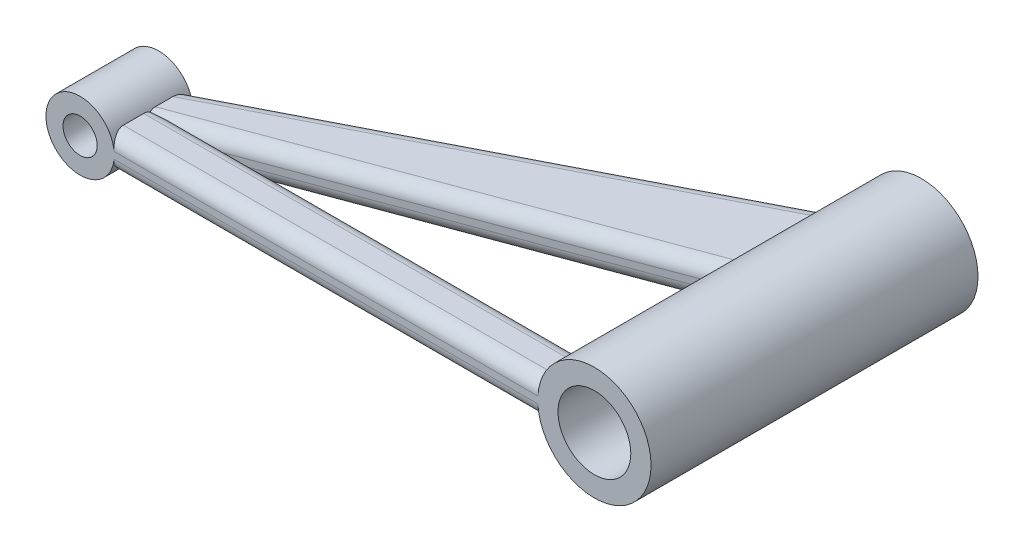
from build123d import *

# Parameters (mm, degrees)
BOSS_EXTRUDE1_DEPTH     = 10
SKETCH2_R               = 10
SKETCH2_R_2             = 5
BOSS_EXTRUDE2_DEPTH     = 23
SKETCH3_R               = 5
CUT_EXTRUDE1_DEPTH      = 27
CUT_EXTRUDE2_DEPTH      = 27
SKETCH5_R               = 16.577091043
SKETCH5_R_2             = 9.5
BOSS_EXTRUDE3_DEPTH     = 95.692095
SKETCH6_R               = 10.655
CUT_EXTRUDE3_DEPTH      = 100
CUT_EXTRUDE4_DEPTH      = 18
CUT_EXTRUDE4_DEPTH_BACK = 49
FILLET1_R               = 4


with BuildPart() as part:
    # Sketch1 → Boss-Extrude1 (new body)
    with BuildSketch(Plane(origin=(0, 0, 0), x_dir=(1, 0, 0), z_dir=(0, 1, 0))):
        Polygon((-63.967417751, -18.920698467), (86.549607935, -18.920698467), (86.549607935, 76.771396129), (-63.967417751, 4.079301533), align=None)
    extrude(amount=BOSS_EXTRUDE1_DEPTH)

    # Sketch2 → Boss-Extrude2 (add)
    with BuildSketch(Plane.XY.offset(18.920698467)):
        with Locations((-63.967417751, 5)):
            Circle(SKETCH2_R)
        with Locations((-63.967417751, 5)):
            Circle(SKETCH2_R_2, mode=Mode.SUBTRACT)
    extrude(amount=-BOSS_EXTRUDE2_DEPTH)

    # Sketch3 → Cut-Extrude1 (cut)
    with BuildSketch(Plane.XY.offset(18.920698467)):
        with Locations((-63.967417751, 5)):
            Circle(SKETCH3_R)
    extrude(amount=-CUT_EXTRUDE1_DEPTH, mode=Mode.SUBTRACT)

    # Sketch4 → Cut-Extrude2 (cut)
    with BuildSketch(Plane(origin=(0, 10, 0), x_dir=(1, 0, 0), z_dir=(0, 1, 0))):
        Polygon((-63.967417751, 4.079301533), (-55.307163713, 4.079301533), (86.549607935, 76.771396129), align=None)
    extrude(amount=-CUT_EXTRUDE2_DEPTH, mode=Mode.SUBTRACT)

    # Sketch5 → Boss-Extrude3 (add)
    with BuildSketch(Plane.XY.offset(18.920698467)):
        with Locations((86.549607935, 5)):
            Circle(SKETCH5_R)
        with Locations((86.549607935, 5)):
            Circle(SKETCH5_R_2, mode=Mode.SUBTRACT)
    extrude(amount=-BOSS_EXTRUDE3_DEPTH)

    # Sketch6 → Cut-Extrude3 (cut)
    with BuildSketch(Plane.XY.offset(18.920698467)):
        with Locations((86.549607935, 5)):
            Circle(SKETCH6_R)
    extrude(amount=-CUT_EXTRUDE3_DEPTH, mode=Mode.SUBTRACT)

    # Sketch7 → Cut-Extrude4 (cut, two sides: drawn at the far end of the back side and taken through both)
    with BuildSketch(Plane(origin=(0, 10, 0), x_dir=(1, 0, 0), z_dir=(0, 1, 0)).offset(-CUT_EXTRUDE4_DEPTH_BACK)):
        Polygon((-42.194742499, -4.96728533), (69.563656526, 36.57746749), (69.563656526, -4.96728533), align=None)
    extrude(amount=CUT_EXTRUDE4_DEPTH + CUT_EXTRUDE4_DEPTH_BACK, mode=Mode.SUBTRACT)

    # Fillet1
    # the kernel refuses this fillet: 4 mm, written as the material it takes off along each edge
    with BuildSketch(Plane(origin=(-64.206738138, 0, 0.481134309), x_dir=(0.45604358422436925, 0, 0.8899574424026075), z_dir=(0.8899574424026077, 0, -0.45604358422436925))) as fillet1_piece_1_section:
        with BuildLine():
            CenterArc((FILLET1_R, -FILLET1_R), FILLET1_R, 90, 90)
            Line((0, -FILLET1_R), (0, 0))
            Line((0, 0), (FILLET1_R, 0))
        make_face()
    fillet1_piece_1 = extrude(amount=161.63790854, mode=Mode.PRIVATE)
    fillet1_piece_1 = fillet1_piece_1 & Plane(origin=(-63.967417751, 5, 0.481134309), x_dir=(1, 0, 0), z_dir=(0, 0, 1)) * Cylinder(10, 340, mode=Mode.PRIVATE)
    fillet1_piece_1 = split(fillet1_piece_1, bisect_by=Plane(origin=(-64.206738138, 0, -4.079301533), z_dir=(0, 0, -1)), keep=Keep.TOP, mode=Mode.PRIVATE)
    add(fillet1_piece_1, mode=Mode.SUBTRACT)
    with BuildSketch(Plane(origin=(-64.206738138, 0, 0.481134309), x_dir=(0.45604358422436925, 0, 0.8899574424026075), z_dir=(0.8899574424026077, 0, -0.45604358422436925))) as fillet1_piece_2_section:
        with BuildLine():
            CenterArc((FILLET1_R, -FILLET1_R), FILLET1_R, 90, 90)
            Line((0, -FILLET1_R), (0, 0))
            Line((0, 0), (FILLET1_R, 0))
        make_face()
    fillet1_piece_2 = extrude(amount=161.63790854, mode=Mode.PRIVATE)
    fillet1_piece_2 = fillet1_piece_2 - Plane(origin=(-63.967417751, 5, 0.481134309), x_dir=(1, 0, 0), z_dir=(0, 0, 1)) * Cylinder(10, 340, mode=Mode.PRIVATE)
    fillet1_piece_2 = split(fillet1_piece_2, bisect_by=Plane(origin=(-64.206738138, 0, -4.079301533), z_dir=(0, 0, 1)), keep=Keep.TOP, mode=Mode.PRIVATE)
    add(fillet1_piece_2, mode=Mode.SUBTRACT)
    with BuildSketch(Plane(origin=(-64.206738138, 0, 0.481134309), x_dir=(0.45604358422436925, 0, 0.8899574424026075), z_dir=(0.8899574424026077, 0, -0.45604358422436925))) as fillet1_piece_3_section:
        with BuildLine():
            CenterArc((FILLET1_R, -FILLET1_R), FILLET1_R, 90, 90)
            Line((0, -FILLET1_R), (0, 0))
            Line((0, 0), (FILLET1_R, 0))
        make_face()
    fillet1_piece_3 = extrude(amount=161.63790854, mode=Mode.PRIVATE)
    fillet1_piece_3 = fillet1_piece_3 - Plane(origin=(-63.967417751, 5, 0.481134309), x_dir=(1, 0, 0), z_dir=(0, 0, 1)) * Cylinder(10, 340, mode=Mode.PRIVATE)
    fillet1_piece_3 = fillet1_piece_3 - Plane(origin=(86.549607935, 5, 0.481134309), x_dir=(1, 0, 0), z_dir=(0, 0, 1)) * Cylinder(16.577091043, 340, mode=Mode.PRIVATE)
    fillet1_piece_3 = split(fillet1_piece_3, bisect_by=Plane(origin=(-64.206738138, 0, -4.079301533), z_dir=(0, 0, -1)), keep=Keep.TOP, mode=Mode.PRIVATE)
    add(fillet1_piece_3, mode=Mode.SUBTRACT)
    with BuildSketch(Plane(origin=(-64.206738138, 10, 0.481134309), x_dir=(0.45604358422436925, 0, 0.8899574424026077), z_dir=(0.8899574424026077, 0, -0.45604358422436925))) as fillet1_piece_4_section:
        with BuildLine():
            CenterArc((FILLET1_R, FILLET1_R), FILLET1_R, 180, 90)
            Line((0, FILLET1_R), (0, 0))
            Line((0, 0), (FILLET1_R, 0))
        make_face()
    fillet1_piece_4 = extrude(amount=161.63790854, mode=Mode.PRIVATE)
    fillet1_piece_4 = fillet1_piece_4 & Plane(origin=(-63.967417751, 5, 0.481134309), x_dir=(1, 0, 0), z_dir=(0, 0, 1)) * Cylinder(10, 340, mode=Mode.PRIVATE)
    fillet1_piece_4 = split(fillet1_piece_4, bisect_by=Plane(origin=(-64.206738138, 10, -4.079301533), z_dir=(0, 0, -1)), keep=Keep.TOP, mode=Mode.PRIVATE)
    add(fillet1_piece_4, mode=Mode.SUBTRACT)
    with BuildSketch(Plane(origin=(-64.206738138, 10, 0.481134309), x_dir=(0.45604358422436925, 0, 0.8899574424026077), z_dir=(0.8899574424026077, 0, -0.45604358422436925))) as fillet1_piece_5_section:
        with BuildLine():
            CenterArc((FILLET1_R, FILLET1_R), FILLET1_R, 180, 90)
            Line((0, FILLET1_R), (0, 0))
            Line((0, 0), (FILLET1_R, 0))
        make_face()
    fillet1_piece_5 = extrude(amount=161.63790854, mode=Mode.PRIVATE)
    fillet1_piece_5 = fillet1_piece_5 - Plane(origin=(-63.967417751, 5, 0.481134309), x_dir=(1, 0, 0), z_dir=(0, 0, 1)) * Cylinder(10, 340, mode=Mode.PRIVATE)
    fillet1_piece_5 = split(fillet1_piece_5, bisect_by=Plane(origin=(-64.206738138, 10, -4.079301533), z_dir=(0, 0, 1)), keep=Keep.TOP, mode=Mode.PRIVATE)
    add(fillet1_piece_5, mode=Mode.SUBTRACT)
    with BuildSketch(Plane(origin=(-64.206738138, 10, 0.481134309), x_dir=(0.45604358422436925, 0, 0.8899574424026077), z_dir=(0.8899574424026077, 0, -0.45604358422436925))) as fillet1_piece_6_section:
        with BuildLine():
            CenterArc((FILLET1_R, FILLET1_R), FILLET1_R, 180, 90)
            Line((0, FILLET1_R), (0, 0))
            Line((0, 0), (FILLET1_R, 0))
        make_face()
    fillet1_piece_6 = extrude(amount=161.63790854, mode=Mode.PRIVATE)
    fillet1_piece_6 = fillet1_piece_6 - Plane(origin=(-63.967417751, 5, 0.481134309), x_dir=(1, 0, 0), z_dir=(0, 0, 1)) * Cylinder(10, 340, mode=Mode.PRIVATE)
    fillet1_piece_6 = fillet1_piece_6 - Plane(origin=(86.549607935, 5, 0.481134309), x_dir=(1, 0, 0), z_dir=(0, 0, 1)) * Cylinder(16.577091043, 340, mode=Mode.PRIVATE)
    fillet1_piece_6 = split(fillet1_piece_6, bisect_by=Plane(origin=(-64.206738138, 10, -4.079301533), z_dir=(0, 0, -1)), keep=Keep.TOP, mode=Mode.PRIVATE)
    add(fillet1_piece_6, mode=Mode.SUBTRACT)
    with BuildSketch(Plane(origin=(78.936964713, 0, -40.061874704), x_dir=(-0.34844072135662324, 0, -0.9373308187083554), z_dir=(-0.9373308187083556, 0, 0.34844072135662324))) as fillet1_piece_7_section:
        with BuildLine():
            CenterArc((FILLET1_R, -FILLET1_R), FILLET1_R, 90, 90)
            Line((0, -FILLET1_R), (0, 0))
            Line((0, 0), (FILLET1_R, 0))
        make_face()
    fillet1_piece_7 = extrude(amount=146.230475297, mode=Mode.PRIVATE)
    fillet1_piece_7 = split(fillet1_piece_7, bisect_by=Plane(origin=(78.936964713, 0, 4.96728533), z_dir=(0, 0, -1)), keep=Keep.TOP, mode=Mode.PRIVATE)
    fillet1_piece_7 = split(fillet1_piece_7, bisect_by=Plane(origin=(69.563656526, 0, -40.061874704), z_dir=(-1, 0, 0)), keep=Keep.TOP, mode=Mode.PRIVATE)
    add(fillet1_piece_7, mode=Mode.SUBTRACT)
    with BuildSketch(Plane(origin=(78.936964713, 10, -40.061874704), x_dir=(-0.34844072135662324, 0, -0.9373308187083554), z_dir=(-0.9373308187083556, 0, 0.34844072135662324))) as fillet1_piece_8_section:
        with BuildLine():
            CenterArc((FILLET1_R, FILLET1_R), FILLET1_R, 180, 90)
            Line((0, FILLET1_R), (0, 0))
            Line((0, 0), (FILLET1_R, 0))
        make_face()
    fillet1_piece_8 = extrude(amount=146.230475297, mode=Mode.PRIVATE)
    fillet1_piece_8 = split(fillet1_piece_8, bisect_by=Plane(origin=(78.936964713, 10, 4.96728533), z_dir=(0, 0, -1)), keep=Keep.TOP, mode=Mode.PRIVATE)
    fillet1_piece_8 = split(fillet1_piece_8, bisect_by=Plane(origin=(69.563656526, 10, -40.061874704), z_dir=(-1, 0, 0)), keep=Keep.TOP, mode=Mode.PRIVATE)
    add(fillet1_piece_8, mode=Mode.SUBTRACT)
    with BuildSketch(Plane(origin=(-59.194742499, 0, 4.96728533), x_dir=(0, 0, 1), z_dir=(1, 0, 0))) as fillet1_piece_9_section:
        with BuildLine():
            CenterArc((FILLET1_R, -FILLET1_R), FILLET1_R, 90, 90)
            Line((0, -FILLET1_R), (0, 0))
            Line((0, 0), (FILLET1_R, 0))
        make_face()
    fillet1_piece_9 = extrude(amount=128.758399025, mode=Mode.PRIVATE)
    fillet1_piece_9 = split(fillet1_piece_9, bisect_by=Plane(origin=(-57.130756582, 0, 10.519557182), z_dir=(0.34844072135662324, 0, 0.9373308187083556)), keep=Keep.TOP, mode=Mode.PRIVATE)
    add(fillet1_piece_9, mode=Mode.SUBTRACT)
    with BuildSketch(Plane(origin=(-59.194742499, 10, 4.96728533), x_dir=(0, 0, 1), z_dir=(1, 0, 0))) as fillet1_piece_10_section:
        with BuildLine():
            CenterArc((FILLET1_R, FILLET1_R), FILLET1_R, 180, 90)
            Line((0, FILLET1_R), (0, 0))
            Line((0, 0), (FILLET1_R, 0))
        make_face()
    fillet1_piece_10 = extrude(amount=128.758399025, mode=Mode.PRIVATE)
    fillet1_piece_10 = split(fillet1_piece_10, bisect_by=Plane(origin=(-57.130756582, 10, 10.519557182), z_dir=(0.34844072135662324, 0, 0.9373308187083556)), keep=Keep.TOP, mode=Mode.PRIVATE)
    add(fillet1_piece_10, mode=Mode.SUBTRACT)
    with BuildSketch(Plane(origin=(-65.307163713, 0, 18.920698467), x_dir=(0, 1, 0), z_dir=(1, 0, 0))) as fillet1_piece_11_section:
        with BuildLine():
            CenterArc((FILLET1_R, -FILLET1_R), FILLET1_R, 90, 90)
            Line((0, -FILLET1_R), (0, 0))
            Line((0, 0), (FILLET1_R, 0))
        make_face()
    fillet1_piece_11 = extrude(amount=146.051710831, mode=Mode.PRIVATE)
    fillet1_piece_11 = fillet1_piece_11 - Plane(origin=(-63.967417751, 5, 18.920698467), x_dir=(1, 0, 0), z_dir=(0, 0, 1)) * Cylinder(10, 309, mode=Mode.PRIVATE)
    fillet1_piece_11 = fillet1_piece_11 - Plane(origin=(86.549607935, 5, 18.920698467), x_dir=(1, 0, 0), z_dir=(0, 0, 1)) * Cylinder(16.577091043, 309, mode=Mode.PRIVATE)
    add(fillet1_piece_11, mode=Mode.SUBTRACT)
    with BuildSketch(Plane(origin=(-65.307163713, 10, 18.920698467), x_dir=(0, -1, 0), z_dir=(1, 0, 0))) as fillet1_piece_12_section:
        with BuildLine():
            CenterArc((FILLET1_R, FILLET1_R), FILLET1_R, 180, 90)
            Line((0, FILLET1_R), (0, 0))
            Line((0, 0), (FILLET1_R, 0))
        make_face()
    fillet1_piece_12 = extrude(amount=146.051710831, mode=Mode.PRIVATE)
    fillet1_piece_12 = fillet1_piece_12 - Plane(origin=(-63.967417751, 5, 18.920698467), x_dir=(1, 0, 0), z_dir=(0, 0, 1)) * Cylinder(10, 309, mode=Mode.PRIVATE)
    fillet1_piece_12 = fillet1_piece_12 - Plane(origin=(86.549607935, 5, 18.920698467), x_dir=(1, 0, 0), z_dir=(0, 0, 1)) * Cylinder(16.577091043, 309, mode=Mode.PRIVATE)
    add(fillet1_piece_12, mode=Mode.SUBTRACT)
    with BuildSketch(Plane(origin=(78.936964713, 0, -40.061874704), x_dir=(-0.34844072135662324, 0, -0.9373308187083554), z_dir=(-0.9373308187083556, 0, 0.34844072135662324))) as fillet1_piece_13a_section:
        with BuildLine():
            CenterArc((FILLET1_R, -FILLET1_R), FILLET1_R, 90, 90)
            Line((0, -FILLET1_R), (0, 0))
            Line((0, 0), (FILLET1_R, 0))
        make_face()
    fillet1_piece_13a = extrude(amount=146.230475297, mode=Mode.PRIVATE)
    fillet1_piece_13a = fillet1_piece_13a - Plane(origin=(-63.967417751, 5, -40.061874704), x_dir=(1, 0, 0), z_dir=(0, 0, 1)) * Cylinder(10, 309, mode=Mode.PRIVATE)
    fillet1_piece_13a = split(fillet1_piece_13a, bisect_by=Plane(origin=(78.936964713, 0, 4.96728533), z_dir=(0, 0, 1)), keep=Keep.TOP, mode=Mode.PRIVATE)
    with BuildSketch(Plane(origin=(-59.194742499, 0, 4.96728533), x_dir=(0, 0, 1), z_dir=(1, 0, 0))) as fillet1_piece_13b_section:
        with BuildLine():
            CenterArc((FILLET1_R, -FILLET1_R), FILLET1_R, 90, 90)
            Line((0, -FILLET1_R), (0, 0))
            Line((0, 0), (FILLET1_R, 0))
        make_face()
    fillet1_piece_13b = extrude(amount=128.758399025, mode=Mode.PRIVATE)
    fillet1_piece_13b = fillet1_piece_13b - Plane(origin=(-63.967417751, 5, 4.96728533), x_dir=(1, 0, 0), z_dir=(0, 0, 1)) * Cylinder(10, 274, mode=Mode.PRIVATE)
    fillet1_piece_13b = split(fillet1_piece_13b, bisect_by=Plane(origin=(-57.130756582, 0, 10.519557182), z_dir=(-0.34844072135662324, 0, -0.9373308187083556)), keep=Keep.TOP, mode=Mode.PRIVATE)
    fillet1_piece_13 = fillet1_piece_13a & fillet1_piece_13b
    add(fillet1_piece_13, mode=Mode.SUBTRACT)
    with BuildSketch(Plane(origin=(78.936964713, 10, -40.061874704), x_dir=(-0.34844072135662324, 0, -0.9373308187083554), z_dir=(-0.9373308187083556, 0, 0.34844072135662324))) as fillet1_piece_14a_section:
        with BuildLine():
            CenterArc((FILLET1_R, FILLET1_R), FILLET1_R, 180, 90)
            Line((0, FILLET1_R), (0, 0))
            Line((0, 0), (FILLET1_R, 0))
        make_face()
    fillet1_piece_14a = extrude(amount=146.230475297, mode=Mode.PRIVATE)
    fillet1_piece_14a = fillet1_piece_14a - Plane(origin=(-63.967417751, 5, -40.061874704), x_dir=(1, 0, 0), z_dir=(0, 0, 1)) * Cylinder(10, 309, mode=Mode.PRIVATE)
    fillet1_piece_14a = split(fillet1_piece_14a, bisect_by=Plane(origin=(78.936964713, 10, 4.96728533), z_dir=(0, 0, 1)), keep=Keep.TOP, mode=Mode.PRIVATE)
    with BuildSketch(Plane(origin=(-59.194742499, 10, 4.96728533), x_dir=(0, 0, 1), z_dir=(1, 0, 0))) as fillet1_piece_14b_section:
        with BuildLine():
            CenterArc((FILLET1_R, FILLET1_R), FILLET1_R, 180, 90)
            Line((0, FILLET1_R), (0, 0))
            Line((0, 0), (FILLET1_R, 0))
        make_face()
    fillet1_piece_14b = extrude(amount=128.758399025, mode=Mode.PRIVATE)
    fillet1_piece_14b = fillet1_piece_14b - Plane(origin=(-63.967417751, 5, 4.96728533), x_dir=(1, 0, 0), z_dir=(0, 0, 1)) * Cylinder(10, 274, mode=Mode.PRIVATE)
    fillet1_piece_14b = split(fillet1_piece_14b, bisect_by=Plane(origin=(-57.130756582, 10, 10.519557182), z_dir=(-0.34844072135662324, 0, -0.9373308187083556)), keep=Keep.TOP, mode=Mode.PRIVATE)
    fillet1_piece_14 = fillet1_piece_14a & fillet1_piece_14b
    add(fillet1_piece_14, mode=Mode.SUBTRACT)


solid = part.part
